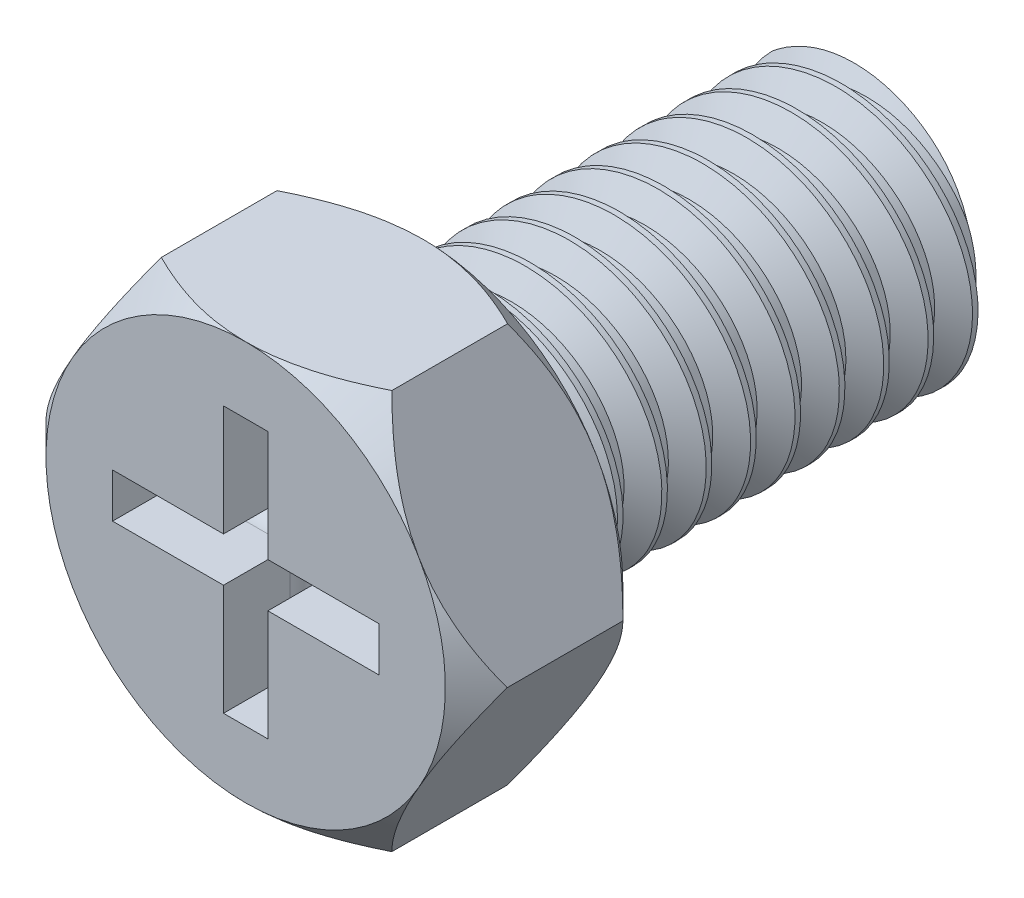
from build123d import *

# Parameters (mm, degrees)
BOSS_EXTRUDE1_DEPTH      = 2
BOSS_EXTRUDE2_DEPTH      = 2
BOSS_EXTRUDE2_DEPTH_BACK = 5
SKETCH1_3_R              = 1.5
THREAD1_PITCH            = 0.5
SKETCH1_8_OUTSIDE_W      = 11.158
SKETCH1_8_OUTSIDE_H      = 10.462
SKETCH1_8_OUTSIDE_R      = 2.25
CUT_EXTRUDE3_DEPTH       = 1
CUT_EXTRUDE3_DRAFT       = 45
SKETCH8_OUTSIDE_W        = 11.158
SKETCH8_OUTSIDE_H        = 10.462
SKETCH8_OUTSIDE_R        = 2.25
CUT_EXTRUDE4_DEPTH       = 1
CUT_EXTRUDE4_DRAFT       = -45
CUT_EXTRUDE5_DEPTH       = 1
FILLET1_R                = 0.25


with BuildPart() as part:
    # Sketch1 → Boss-Extrude1 (new body)
    with BuildSketch(Plane.XY):
        Polygon((2.598076211, 0), (1.299038106, 2.25), (-1.299038106, 2.25), (-2.598076211, 0), (-1.299038106, -2.25), (1.299038106, -2.25), align=None)
    extrude(amount=BOSS_EXTRUDE1_DEPTH)

    # Sketch1<3> → Boss-Extrude2 (add, two sides: drawn at the far end of the back side and taken through both)
    with BuildSketch(Plane.XY.offset(-BOSS_EXTRUDE2_DEPTH_BACK)):
        Circle(SKETCH1_3_R)
    extrude(amount=BOSS_EXTRUDE2_DEPTH + BOSS_EXTRUDE2_DEPTH_BACK)

    # Thread1: the profile of Thread Profile2 profile screwed along a right-hand helix of 10 turns, 6 arcs to a turn; built about Z, then put on its axis
    thread1_z = Axis((0, 0, 0), (0, 0, 1))
    thread1_corners = [(1.5003, 0, -0.000173205), (1.5003, 0, 0.437673204), (1.229367063, 0, 0.281249999), (1.229367063, 0, 0.156249999)]
    with BuildLine(mode=Mode.PRIVATE) as thread1_profile:
        Line(thread1_corners[0], thread1_corners[1])
        Line(thread1_corners[1], thread1_corners[2])
        Line(thread1_corners[2], thread1_corners[3])
        Line(thread1_corners[3], thread1_corners[0])
    thread1_cap = Face(thread1_profile.wire())
    thread1_turn_angles = [0, 30, 60, 90, 120, 150, 180, 210, 240, 270, 300, 330, 360]
    thread1_turn_weights = [1, 0.8660254037844387, 1, 0.8660254037844387, 1, 0.8660254037844387, 1, 0.8660254037844387, 1, 0.8660254037844387, 1, 0.8660254037844387, 1]
    thread1_turn_rails = [Edge.make_bspline([Vector(p[0], p[1], 0).rotate(thread1_z, thread1_turn_angles[k]) / thread1_turn_weights[k] + Vector(0, 0, p[2] + THREAD1_PITCH * thread1_turn_angles[k] / 360) for k in range(13)], [0, 0, 0, 1, 1, 2, 2, 3, 3, 4, 4, 5, 5, 6, 6, 6], 2, thread1_turn_weights) for p in thread1_corners]
    thread1_turn_sides = [Face.make_surface_from_curves(thread1_turn_rails[p[0]], thread1_turn_rails[p[1]]) for p in [(0, 1), (1, 2), (2, 3), (3, 0)]]
    thread1 = Plane(origin=(0, 0, 0), x_dir=(-1, 0, 0), z_dir=(0, 0, -1)) * Solid(Shell([*[p.moved(Location((0, 0, THREAD1_PITCH * i))) for i in range(10) for p in thread1_turn_sides], thread1_cap, thread1_cap.rotate(thread1_z, 3600).moved(Location((0, 0, THREAD1_PITCH * 3600 / 360)))]))
    add(thread1, mode=Mode.SUBTRACT)


with BuildPart() as cut_extrude3_tool:
    # Sketch1<8> outside → Cut-Extrude3 (with draft: the straight prism first)
    with BuildSketch(Plane.XY):
        Rectangle(SKETCH1_8_OUTSIDE_W, SKETCH1_8_OUTSIDE_H)
        Circle(SKETCH1_8_OUTSIDE_R, mode=Mode.SUBTRACT)
    extrude(amount=CUT_EXTRUDE3_DEPTH)
    # Cut-Extrude3: the draft: its side faces are tilted about the plane it starts from
    cut_extrude3_sides = [cut_extrude3_tool.faces().sort_by_distance(p)[0] for p in [
        (0, -5.231, 0.5),
        (5.579, 0, 0.5),
        (0, 5.231, 0.5),
        (-5.579, 0, 0.5),
        (-2.25, 0, 0.5),
    ]]
    draft(cut_extrude3_sides, Plane.XY, CUT_EXTRUDE3_DRAFT)


with BuildPart() as part_1:
    add(part.part)

    # Cut-Extrude3: cut by cut_extrude3_tool
    add(cut_extrude3_tool.part, mode=Mode.SUBTRACT)


with BuildPart() as cut_extrude4_tool:
    # Sketch8 outside → Cut-Extrude4 (with draft: the straight prism first)
    with BuildSketch(Plane.XY.offset(2)):
        Rectangle(SKETCH8_OUTSIDE_W, SKETCH8_OUTSIDE_H)
        Circle(SKETCH8_OUTSIDE_R, mode=Mode.SUBTRACT)
    extrude(amount=-CUT_EXTRUDE4_DEPTH)
    # Cut-Extrude4: the draft: its side faces are tilted about the plane it starts from
    cut_extrude4_sides = [cut_extrude4_tool.faces().sort_by_distance(p)[0] for p in [
        (0, -5.231, 1.5),
        (5.579, 0, 1.5),
        (0, 5.231, 1.5),
        (-5.579, 0, 1.5),
        (-2.25, 0, 1.5),
    ]]
    draft(cut_extrude4_sides, Plane.XY.offset(2), CUT_EXTRUDE4_DRAFT)


with BuildPart() as part_2:
    add(part_1.part)

    # Cut-Extrude4: cut by cut_extrude4_tool
    add(cut_extrude4_tool.part, mode=Mode.SUBTRACT)

    # Sketch10 → Cut-Extrude5 (cut)
    with BuildSketch(Plane.XY.offset(2)):
        Polygon((-0.25, -1.5), (0.25, -1.5), (0.25, -0.25), (1.5, -0.25), (1.5, 0.25), (0.25, 0.25), (0.25, 1.5), (-0.25, 1.5), (-0.25, 0.25), (-1.5, 0.25), (-1.5, -0.25), (-0.25, -0.25), align=None)
    extrude(amount=-CUT_EXTRUDE5_DEPTH, mode=Mode.SUBTRACT)

    # Fillet1
    fillet1_edges = [part_2.edges().sort_by_distance(p)[0] for p in [
        (-0.25, -0.875, 1),
        (-0.875, -0.25, 1),
        (-1.5, 0, 1),
        (-0.875, 0.25, 1),
        (-0.25, 0.875, 1),
        (0, 1.5, 1),
        (0.25, 0.875, 1),
        (0.875, 0.25, 1),
        (1.5, 0, 1),
        (0.875, -0.25, 1),
        (0.25, -0.875, 1),
        (0, -1.5, 1),
    ]]
    fillet(fillet1_edges, radius=FILLET1_R - 0.0001)  # a hair under: the kernel refuses the full size


solid = part_2.part
